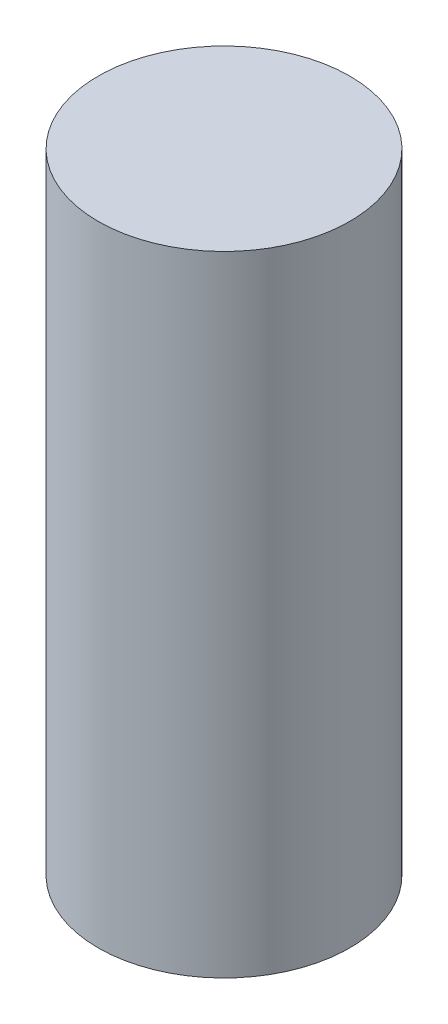
from build123d import *

# Parameters (mm, degrees)
SKETCH1_R           = 20
BOSS_EXTRUDE1_DEPTH = 100
SKETCH2_R           = 2
CUT_EXTRUDE1_DEPTH  = 20


with BuildPart() as part:
    # Sketch1 → Boss-Extrude1 (new body)
    with BuildSketch(Plane(origin=(0, 0, 0), x_dir=(1, 0, 0), z_dir=(0, 1, 0))):
        Circle(SKETCH1_R)
    extrude(amount=BOSS_EXTRUDE1_DEPTH)

    # Sketch2 → Cut-Extrude1 (cut)
    with BuildSketch(Plane.XZ):
        Circle(SKETCH2_R)
    extrude(amount=-CUT_EXTRUDE1_DEPTH, mode=Mode.SUBTRACT)


solid = part.part
